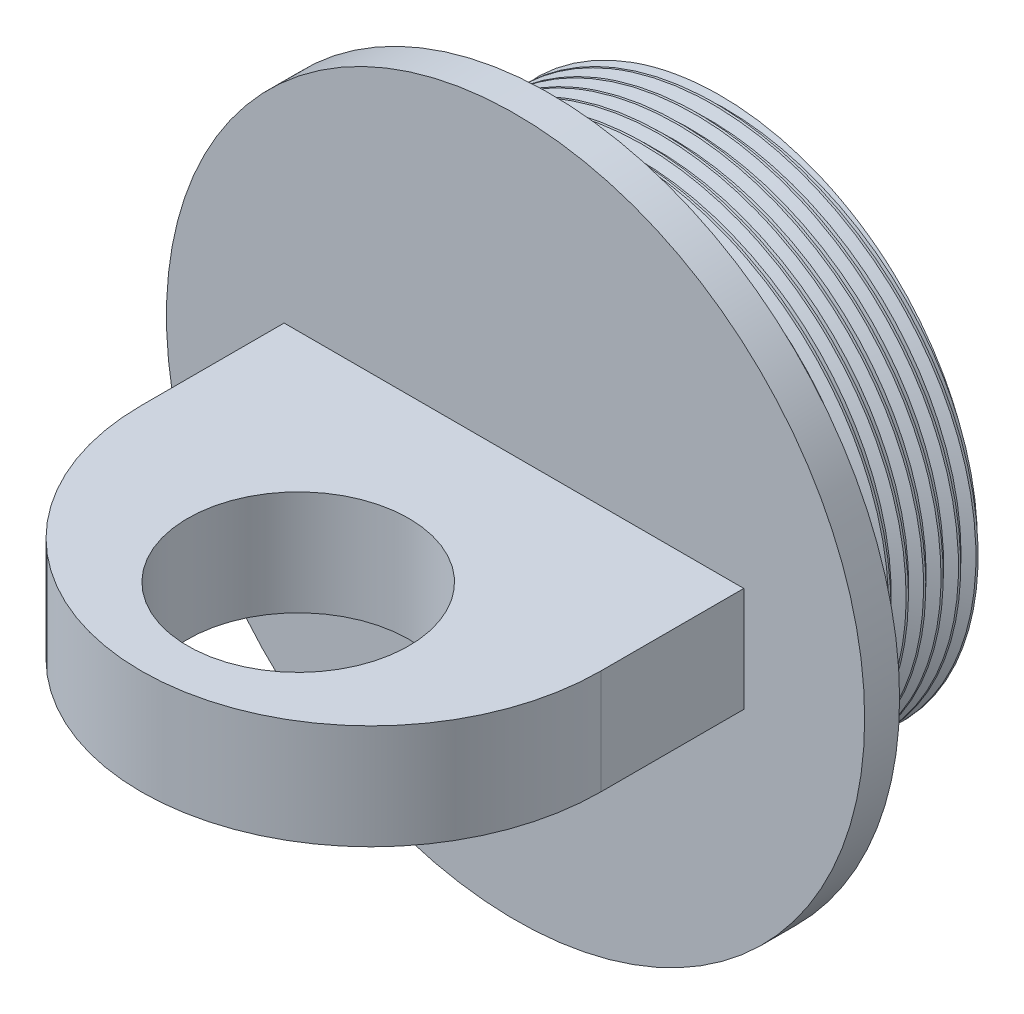
from build123d import *

# Parameters (mm, degrees)
SKETCH2_R               = 25.4
BOSS_EXTRUDE1_DEPTH     = 2.54
BOSS_EXTRUDE2_DEPTH     = 3.81
CUT_EXTRUDE1_DEPTH      = 49.765534641
CUT_EXTRUDE1_DEPTH_BACK = 49.765534641
SKETCH5_R               = 8.04431173
SKETCH6_R               = 19.05
BOSS_EXTRUDE3_DEPTH     = 12.7
THREAD1_PITCH           = 1.27


with BuildPart() as part:
    # Sketch2 → Boss-Extrude1 (new body)
    with BuildSketch(Plane(origin=(0, 0, 0), x_dir=(0, 1, 0), z_dir=(0, 0, 1))):
        with Locations(Location((0, 0, 0), (0, 0, 270))):
            Circle(SKETCH2_R)
    extrude(amount=BOSS_EXTRUDE1_DEPTH)

    # Sketch4 → Boss-Extrude2 (add, symmetric)
    with BuildSketch(Plane(origin=(0, 0, 0), x_dir=(-1, 0, 0), z_dir=(0, 1, 0))):
        with BuildLine():
            Line((-16.605038604, 2.54), (-16.605038604, 12.937891369))
            ThreePointArc((-16.605038604, 12.937891369), (0.116693571, 29.659623544), (16.838425746, 12.937891369))
            Line((16.838425746, 12.937891369), (16.838425746, 2.54))
            Line((16.838425746, 2.54), (-16.605038604, 2.54))
        make_face()
    extrude(amount=BOSS_EXTRUDE2_DEPTH, both=True)

    # Sketch5 → Cut-Extrude1 (cut, two sides: drawn at the far end of the back side and taken through both)
    with BuildSketch(Plane(origin=(0, 3.81, 0), x_dir=(-1, 0, 0), z_dir=(0, 1, 0)).offset(-CUT_EXTRUDE1_DEPTH_BACK)):
        with Locations(Location((0, 18.352312331, 0), (0, 0, 270))):
            Circle(SKETCH5_R)
    extrude(amount=CUT_EXTRUDE1_DEPTH + CUT_EXTRUDE1_DEPTH_BACK, mode=Mode.SUBTRACT)

    # Sketch6 → Boss-Extrude3 (add)
    with BuildSketch(Plane(origin=(0, 0, 0), x_dir=(1, 0, 0), z_dir=(0, 0, -1))):
        with Locations(Location((0, 0, 0), (0, 0, 180))):
            Circle(SKETCH6_R)
    extrude(amount=BOSS_EXTRUDE3_DEPTH)

    # Thread1: the profile of Thread Profile1 profile screwed along a right-hand helix of 10 turns, 8 arcs to a turn; built about Z, then put on its axis
    thread1_z = Axis((0, 0, 0), (0, 0, 1))
    thread1_corners = [(19.0503, 0, -0.000173205), (19.0503, 0, 1.111423202), (18.362592339, 0, 0.714374998), (18.362592339, 0, 0.396874998)]
    with BuildLine(mode=Mode.PRIVATE) as thread1_profile:
        Line(thread1_corners[0], thread1_corners[1])
        Line(thread1_corners[1], thread1_corners[2])
        Line(thread1_corners[2], thread1_corners[3])
        Line(thread1_corners[3], thread1_corners[0])
    thread1_cap = Face(thread1_profile.wire())
    thread1_turn_angles = [0, 22.5, 45, 67.5, 90, 112.5, 135, 157.5, 180, 202.5, 225, 247.5, 270, 292.5, 315, 337.5, 360]
    thread1_turn_weights = [1, 0.9238795325112867, 1, 0.9238795325112867, 1, 0.9238795325112867, 1, 0.9238795325112867, 1, 0.9238795325112867, 1, 0.9238795325112867, 1, 0.9238795325112867, 1, 0.9238795325112867, 1]
    thread1_turn_rails = [Edge.make_bspline([Vector(p[0], p[1], 0).rotate(thread1_z, thread1_turn_angles[k]) / thread1_turn_weights[k] + Vector(0, 0, p[2] + THREAD1_PITCH * thread1_turn_angles[k] / 360) for k in range(17)], [0, 0, 0, 1, 1, 2, 2, 3, 3, 4, 4, 5, 5, 6, 6, 7, 7, 8, 8, 8], 2, thread1_turn_weights) for p in thread1_corners]
    thread1_turn_sides = [Face.make_surface_from_curves(thread1_turn_rails[p[0]], thread1_turn_rails[p[1]]) for p in [(0, 1), (1, 2), (2, 3), (3, 0)]]
    thread1 = Plane(origin=(0, 0, 0), x_dir=(-1, 0, 0), z_dir=(0, 0, -1)) * Solid(Shell([*[p.moved(Location((0, 0, THREAD1_PITCH * i))) for i in range(10) for p in thread1_turn_sides], thread1_cap, thread1_cap.rotate(thread1_z, 3600).moved(Location((0, 0, THREAD1_PITCH * 3600 / 360)))]))
    add(thread1, mode=Mode.SUBTRACT)


solid = part.part
